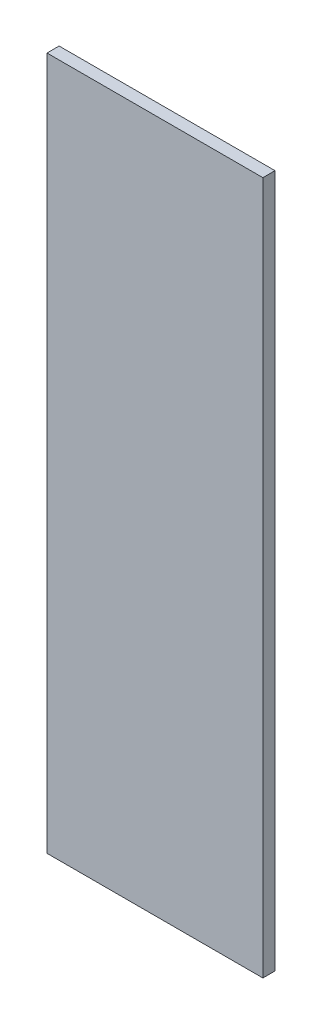
from build123d import *

# Parameters (mm, degrees)
SKETCH1_W           = 56.55
SKETCH1_H           = 181.55
BOSS_EXTRUDE1_DEPTH = 3.175


with BuildPart() as part:
    # Sketch1 → Boss-Extrude1 (new body)
    with BuildSketch(Plane.XY):
        Rectangle(SKETCH1_W, SKETCH1_H)
    extrude(amount=BOSS_EXTRUDE1_DEPTH)


solid = part.part
